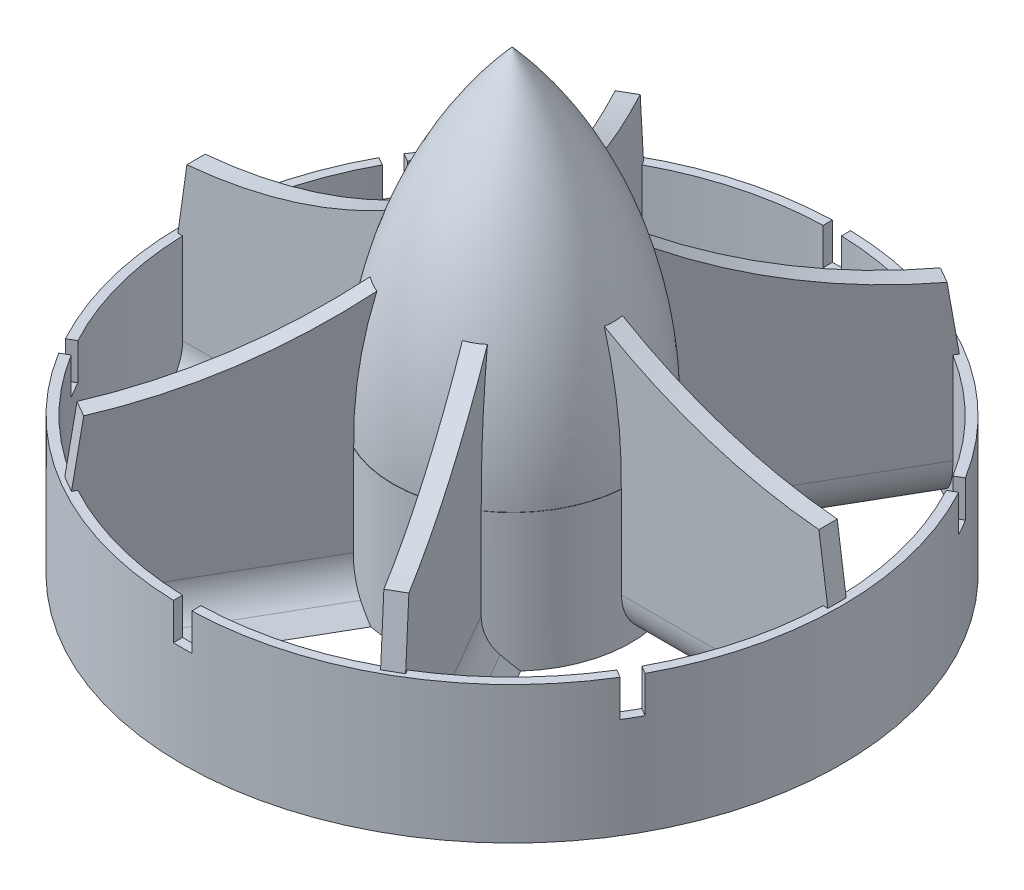
from build123d import *

# Parameters (mm, degrees)
IZIM1_R                        = 13
Y_KSEKLIK_EKSTR_ZYON1_DEPTH    = 15
IZIM1_3_R                      = 36
IZIM1_3_R_2                    = 35
Y_KSEKLIK_EKSTR_ZYON2_DEPTH    = 15
Y_KSEKLIK_EKSTR_ZYON5_DEPTH    = 35.5
RADYUS5_R                      = 5
RADYUS6_R                      = 5
DAIRESEL_KAPLAMA1_COUNT        = 6
RADYUS5_OF_DAIRESEL_KAPLAMA1_R = 5
RADYUS6_OF_DAIRESEL_KAPLAMA1_R = 5
KES_EKSTR_ZYON1_DEPTH          = 1
DAIRESEL_KAPLAMA2_COUNT        = 6
KES_EKSTR_ZYON2_START          = 40
IZIM13_W                       = 2
IZIM13_H                       = 4
KES_EKSTR_ZYON2_DEPTH          = 10
DAIRESEL_KAPLAMA7_COUNT        = 6
KES_EKSTR_ZYON3_DEPTH          = 1
DAIRESEL_KAPLAMA8_COUNT        = 6


with BuildPart() as part:
    # Çizim1 → Yükseklik-Ekstrüzyon1 (new body)
    with BuildSketch(Plane(origin=(0, 0, 0), x_dir=(1, 0, 0), z_dir=(0, 1, 0))):
        with Locations(Location((0, 0, 0), (0, 0, 270))):
            Circle(IZIM1_R)
    extrude(amount=Y_KSEKLIK_EKSTR_ZYON1_DEPTH)



with BuildPart() as body_2:
    # Çizim1<3> → Yükseklik-Ekstrüzyon2 (new body)
    with BuildSketch(Plane(origin=(0, 0, 0), x_dir=(1, 0, 0), z_dir=(0, 1, 0))):
        with Locations(Location((0, 0, 0), (0, 0, 270))):
            Circle(IZIM1_3_R)
        with Locations(Location((0, 0, 0), (0, 0, 270))):
            Circle(IZIM1_3_R_2, mode=Mode.SUBTRACT)
    extrude(amount=Y_KSEKLIK_EKSTR_ZYON2_DEPTH)


with BuildPart() as part_1:
    add(part.part)

    add(body_2.part)  # Yükseklik-Ekstrüzyon5 merges body 2
    # Çizim4 → Yükseklik-Ekstrüzyon5 (add)
    with BuildSketch(Plane(origin=(0, 0, 0), x_dir=(0, 0, -1), z_dir=(1, 0, 0))):
        Polygon((1, 3), (1, 38), (-1, 38), (-1, 0), (4, 0), align=None)
    y_kseklik_ekstr_zyon5 = extrude(amount=Y_KSEKLIK_EKSTR_ZYON5_DEPTH)

    # Radyus5
    radyus5_edges = [part_1.edges().sort_by_distance(p)[0] for p in [
        (23.973596383, 0, 1),
    ]]
    fillet(radyus5_edges, radius=RADYUS5_R - 0.0001)  # a hair under: the kernel refuses the full size

    # Radyus6
    radyus6_edges = [part_1.edges().sort_by_distance(p)[0] for p in [
        (23.973596383, 3, -1),
    ]]
    fillet(radyus6_edges, radius=RADYUS6_R)

    # Dairesel Kaplama1: Yükseklik-Ekstrüzyon5 ×6 about axis
    dairesel_kaplama1_axis = Axis((0, 0, 0), (0, 1, 0))
    for i in range(1, DAIRESEL_KAPLAMA1_COUNT):
        add(y_kseklik_ekstr_zyon5.rotate(dairesel_kaplama1_axis, i * 360 / DAIRESEL_KAPLAMA1_COUNT))

    # Radyus5 of Dairesel Kaplama1
    radyus5_of_dairesel_kaplama1_edges = [part_1.edges().sort_by_distance(p)[0] for p in [
        (12.852823595, 0, -20.261743488),
        (-11.120772788, 0, -21.261743488),
        (-23.973596383, 0, -1),
        (-12.852823595, 0, 20.261743488),
        (11.120772788, 0, 21.261743488),
    ]]
    fillet(radyus5_of_dairesel_kaplama1_edges, radius=RADYUS5_OF_DAIRESEL_KAPLAMA1_R - 0.0001)  # a hair under: the kernel refuses the full size

    # Radyus6 of Dairesel Kaplama1
    radyus6_of_dairesel_kaplama1_edges = [part_1.edges().sort_by_distance(p)[0] for p in [
        (11.120772788, 3, -21.261743488),
        (-12.852823595, 3, -20.261743488),
        (-23.973596383, 3, 1),
        (-11.120772788, 3, 21.261743488),
        (12.852823595, 3, 20.261743488),
    ]]
    fillet(radyus6_of_dairesel_kaplama1_edges, radius=RADYUS6_OF_DAIRESEL_KAPLAMA1_R)

    # Çizim8 → Kes-Ekstrüzyon1 (cut, symmetric)
    with BuildSketch(Plane.XY):
        with BuildLine():
            Line((35.5, 38), (35.5, 21.885899109))
            ThreePointArc((35.5, 21.885899109), (16.305981992, 26.761720913), (0, 38))
            Line((0, 38), (35.5, 38))
        make_face()
    kes_ekstr_zyon1 = extrude(amount=KES_EKSTR_ZYON1_DEPTH, both=True, mode=Mode.SUBTRACT)

    # Dairesel Kaplama2: Kes-Ekstrüzyon1 ×6 about axis
    dairesel_kaplama2_axis = Axis((0, 70.334505361, 0), (0, -1, 0))
    for i in range(1, DAIRESEL_KAPLAMA2_COUNT):
        add(kes_ekstr_zyon1.rotate(dairesel_kaplama2_axis, i * 360 / DAIRESEL_KAPLAMA2_COUNT), mode=Mode.SUBTRACT)

    # Çizim12 → Döndür1 (revolve)
    with BuildSketch(Plane.XY):
        with BuildLine():
            Line((0, 15), (12.969999724, 15))
            ThreePointArc((12.969999724, 15), (9.768127339, 33.657299179), (0, 49.872430621))
            Line((0, 49.872430621), (0, 15))
        make_face()
    revolve(axis=Axis((0, 70.334505361, 0), (0, -1, 0)))

    # Çizim13 → Kes-Ekstrüzyon2 (cut)
    with BuildSketch(Plane.XY.offset(KES_EKSTR_ZYON2_START)):
        with Locations((0, 13)):
            Rectangle(IZIM13_W, IZIM13_H)
    kes_ekstr_zyon2 = extrude(amount=-KES_EKSTR_ZYON2_DEPTH, mode=Mode.SUBTRACT)

    # Dairesel Kaplama7: Kes-Ekstrüzyon2 ×6 about axis
    dairesel_kaplama7_axis = Axis((0, 0, 0), (0, 1, 0))
    for i in range(1, DAIRESEL_KAPLAMA7_COUNT):
        add(kes_ekstr_zyon2.rotate(dairesel_kaplama7_axis, i * 360 / DAIRESEL_KAPLAMA7_COUNT), mode=Mode.SUBTRACT)

    # Çizim15 → Kes-Ekstrüzyon3 (cut, symmetric)
    with BuildSketch(Plane.XY):
        Polygon((35.5, 15), (34.386615192, 22.92214455), (38.013319205, 23.431844559), align=None)
    kes_ekstr_zyon3 = extrude(amount=KES_EKSTR_ZYON3_DEPTH, both=True, mode=Mode.SUBTRACT)

    # Dairesel Kaplama8: Kes-Ekstrüzyon3 ×6 about axis
    dairesel_kaplama8_axis = Axis((0, 0, 0), (0, 1, 0))
    for i in range(1, DAIRESEL_KAPLAMA8_COUNT):
        add(kes_ekstr_zyon3.rotate(dairesel_kaplama8_axis, i * 360 / DAIRESEL_KAPLAMA8_COUNT), mode=Mode.SUBTRACT)


solid = part_1.part
